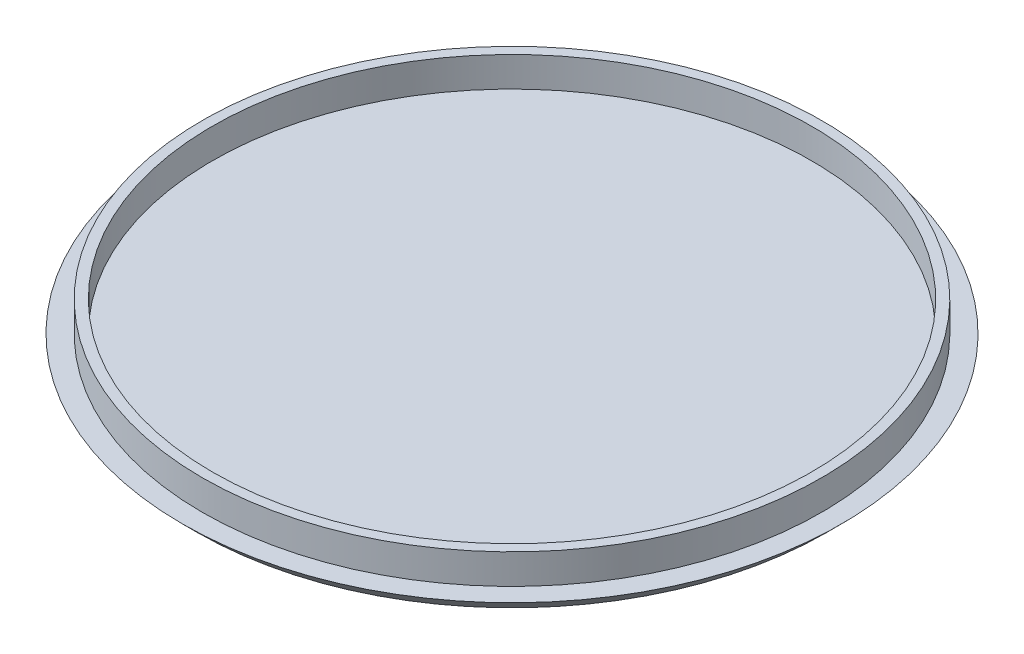
from build123d import *

# Parameters (mm, degrees)
SKETCH2_R           = 16.5
BOSS_EXTRUDE1_DEPTH = 0.75
SKETCH3_R           = 15.5
SKETCH3_R_2         = 15
BOSS_EXTRUDE2_DEPTH = 1.5
CHAMFER1_SIZE       = 0.75


with BuildPart() as part:
    # Sketch2 → Boss-Extrude1 (new body)
    with BuildSketch(Plane(origin=(0, 0, 0), x_dir=(1, 0, 0), z_dir=(0, 1, 0))):
        with Locations(Location((0, 0, 0), (0, 0, 270))):
            Circle(SKETCH2_R)
    extrude(amount=BOSS_EXTRUDE1_DEPTH)

    # Sketch3 → Boss-Extrude2 (add)
    with BuildSketch(Plane(origin=(0, 0.75, 0), x_dir=(1, 0, 0), z_dir=(0, 1, 0))):
        with Locations(Location((0, 0, 0), (0, 0, 270))):
            Circle(SKETCH3_R)
        with Locations(Location((0, 0, 0), (0, 0, 270))):
            Circle(SKETCH3_R_2, mode=Mode.SUBTRACT)
    extrude(amount=BOSS_EXTRUDE2_DEPTH)

    # Chamfer1
    chamfer1_edges = [part.edges().sort_by_distance(p)[0] for p in [
        (0, 0, -16.5),
    ]]
    chamfer(chamfer1_edges, length=CHAMFER1_SIZE - 0.0001)  # a hair under: the kernel refuses the full size


solid = part.part
